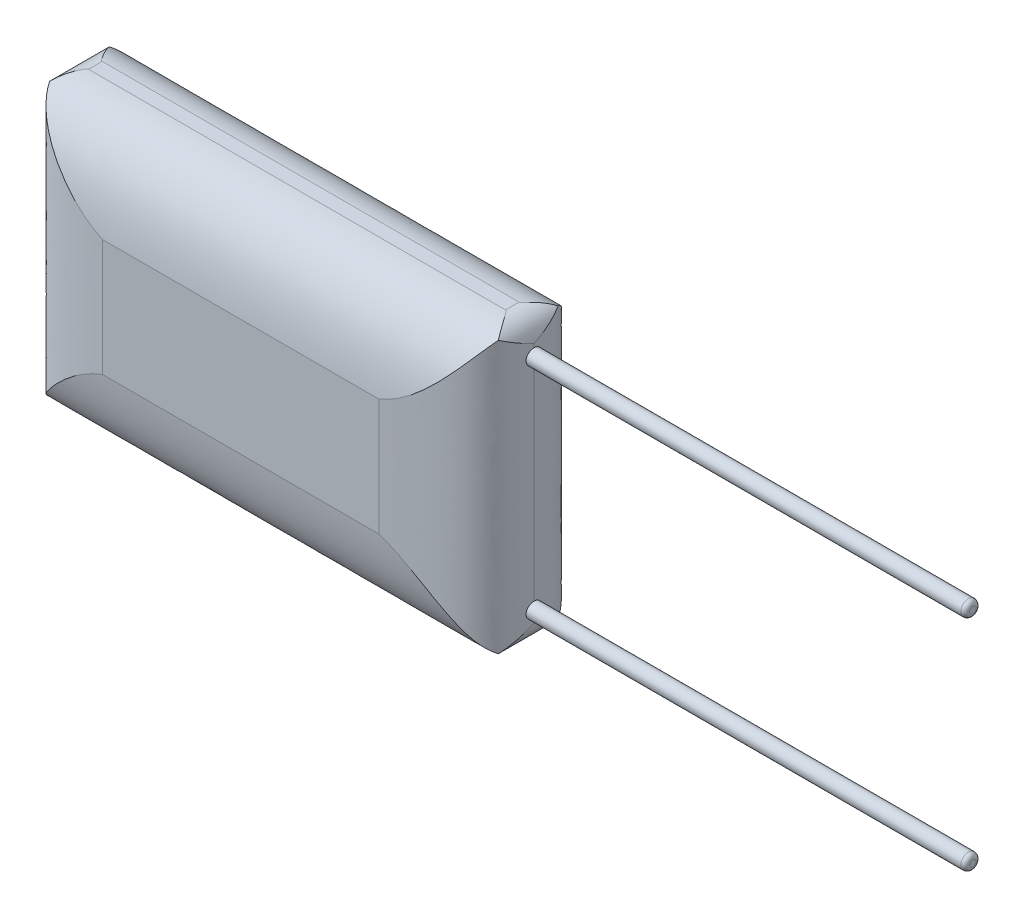
from build123d import *

# Parameters (mm, degrees)
BOSS_EXTRUDE1_DEPTH     = 3
CUT_EXTRUDE1_DEPTH      = 10.5
CUT_EXTRUDE3_DEPTH      = 6.5
CUT_EXTRUDE4_DEPTH      = 6.5
BOSS_EXTRUDE3_START     = 5.241286696
BOSS_EXTRUDE3_OUTLINE_R = 0.175
BOSS_EXTRUDE3_DEPTH     = 10.008713304
BOSS_EXTRUDE4_START     = 5.241286696
BOSS_EXTRUDE4_OUTLINE_R = 0.175
BOSS_EXTRUDE4_DEPTH     = 10.008713304
FILLET5_R               = 0.1


# Read off the part's stored shape, not the designer's step: Boss-Extrude3, Boss-Extrude4
with BuildPart() as part:
    # Sketch1 → Boss-Extrude1 (new body)
    with BuildSketch(Plane.XY):
        with BuildLine():
            Line((-4.75, 3.25), (4.75, 3.25))
            ThreePointArc((4.75, 3.25), (5.103553391, 3.103553391), (5.25, 2.75))
            Line((5.25, 2.75), (5.25, -2.75))
            ThreePointArc((5.25, -2.75), (5.103553391, -3.103553391), (4.75, -3.25))
            Line((4.75, -3.25), (-4.75, -3.25))
            ThreePointArc((-4.75, -3.25), (-5.103553391, -3.103553391), (-5.25, -2.75))
            Line((-5.25, -2.75), (-5.25, 2.75))
            ThreePointArc((-5.25, 2.75), (-5.103553391, 3.103553391), (-4.75, 3.25))
        make_face()
    extrude(amount=BOSS_EXTRUDE1_DEPTH)

    # Sketch2 → Cut-Extrude1 (cut)
    with BuildSketch(Plane.ZY.offset(5.25)):
        with BuildLine():
            Line((1.34430207, 3.25), (0, 3.25))
            Line((0, 3.25), (0, 2.75))
            Line((0, 2.75), (0.47517162, 2.75))
            add(Edge.make_bspline(
                [(1.34430207, 3.25), (0.960479897, 3.229816086), (0.678650256, 3.056054513), (0.47517162, 2.75)],
                knots=[0.045040828, 0.045040828, 0.045040828, 0.045040828, 0.389820888, 0.389820888, 0.389820888, 0.389820888], degree=3))
        make_face()
        with BuildLine():
            Line((0.47517162, 2.75), (0, 2.75))
            Line((0, 2.75), (0, 0))
            add(Edge.make_bspline(
                [(0.47517162, 2.75), (0.115062589, 2.20835594), (0.000353784, 1.252362148), (0, 0)],
                knots=[0.389820888, 0.389820888, 0.389820888, 0.389820888, 1, 1, 1, 1], degree=3))
        make_face()
        with BuildLine():
            Line((3, 3.25), (1.65569793, 3.25))
            add(Edge.make_bspline(
                [(1.65569793, 3.25), (2.039520103, 3.229816086), (2.321349744, 3.056054513), (2.52482838, 2.75)],
                knots=[0.045040828, 0.045040828, 0.045040828, 0.045040828, 0.389820888, 0.389820888, 0.389820888, 0.389820888], degree=3))
            Line((2.52482838, 2.75), (3, 2.75))
            Line((3, 2.75), (3, 3.25))
        make_face()
        with BuildLine():
            Line((3, 2.75), (2.52482838, 2.75))
            add(Edge.make_bspline(
                [(2.52482838, 2.75), (2.884937411, 2.20835594), (2.999646216, 1.252362148), (3, 0)],
                knots=[0.389820888, 0.389820888, 0.389820888, 0.389820888, 1, 1, 1, 1], degree=3))
            Line((3, 0), (3, 2.75))
        make_face()
        with BuildLine():
            Line((3, -2.75), (3, 0))
            add(Edge.make_bspline(
                [(2.52482838, -2.75), (2.884937411, -2.20835594), (2.999646216, -1.252362148), (3, 0)],
                knots=[0.389820888, 0.389820888, 0.389820888, 0.389820888, 1, 1, 1, 1], degree=3))
            Line((2.52482838, -2.75), (3, -2.75))
        make_face()
        with BuildLine():
            Line((3, -2.75), (2.52482838, -2.75))
            add(Edge.make_bspline(
                [(1.65569793, -3.25), (2.039520103, -3.229816086), (2.321349744, -3.056054513), (2.52482838, -2.75)],
                knots=[0.045040828, 0.045040828, 0.045040828, 0.045040828, 0.389820888, 0.389820888, 0.389820888, 0.389820888], degree=3))
            Line((1.65569793, -3.25), (3, -3.25))
            Line((3, -3.25), (3, -2.75))
        make_face()
        with BuildLine():
            Line((0.47517162, -2.75), (0, -2.75))
            Line((0, -2.75), (0, -3.25))
            Line((0, -3.25), (1.34430207, -3.25))
            add(Edge.make_bspline(
                [(1.34430207, -3.25), (0.960479897, -3.229816086), (0.678650256, -3.056054513), (0.47517162, -2.75)],
                knots=[0.045040828, 0.045040828, 0.045040828, 0.045040828, 0.389820888, 0.389820888, 0.389820888, 0.389820888], degree=3))
        make_face()
        with BuildLine():
            add(Edge.make_bspline(
                [(0.47517162, -2.75), (0.115062589, -2.20835594), (0.000353784, -1.252362148), (0, 0)],
                knots=[0.389820888, 0.389820888, 0.389820888, 0.389820888, 1, 1, 1, 1], degree=3))
            Line((0, 0), (0, -2.75))
            Line((0, -2.75), (0.47517162, -2.75))
        make_face()
    extrude(amount=-CUT_EXTRUDE1_DEPTH, mode=Mode.SUBTRACT)

    # Sketch4 → Cut-Extrude3 (cut)
    with BuildSketch(Plane.XZ.offset(3.25)):
        with BuildLine():
            Line((-5.25, 3), (-5.25, 1.5))
            add(Edge.make_bspline(
                [(-5.25, 1.5), (-5.223992888, 3.31984165), (-3.374680022, 2.849797455), (0, 3)],
                knots=[0, 0, 0, 0, 1, 1, 1, 1], degree=3))
            Line((0, 3), (-5.25, 3))
        make_face()
        with BuildLine():
            Line((-5.25, 1.5), (-5.25, 0))
            Line((-5.25, 0), (0, 0))
            add(Edge.make_bspline(
                [(-5.25, 1.5), (-5.223992888, -0.31984165), (-3.374680022, 0.150202545), (0, 0)],
                knots=[0, 0, 0, 0, 1, 1, 1, 1], degree=3))
        make_face()
        with BuildLine():
            add(Edge.make_bspline(
                [(5.25, 1.5), (5.223992888, -0.31984165), (3.374680022, 0.150202545), (0, 0)],
                knots=[0, 0, 0, 0, 1, 1, 1, 1], degree=3))
            Line((0, 0), (5.25, 0))
            Line((5.25, 0), (5.25, 1.5))
        make_face()
        with BuildLine():
            Line((5.25, 3), (0, 3))
            add(Edge.make_bspline(
                [(5.25, 1.5), (5.223992888, 3.31984165), (3.374680022, 2.849797455), (0, 3)],
                knots=[0, 0, 0, 0, 1, 1, 1, 1], degree=3))
            Line((5.25, 1.5), (5.25, 3))
        make_face()
    extrude(amount=-CUT_EXTRUDE3_DEPTH, mode=Mode.SUBTRACT)

    # Sketch5 → Cut-Extrude4 (cut)
    with BuildSketch(Plane.XZ.offset(3.25)):
        Polygon((0, 2.938709394), (4.861969398, 2.938709394), (4.861969398, 3.310845171), (-5.594143983, 3.310845171), (-5.594143983, 2.938709394), align=None)
        Polygon((-5.594143983, 0.061290606), (-5.594143983, -0.310845171), (4.861969398, -0.310845171), (4.861969398, 0.061290606), (0, 0.061290606), align=None)
    extrude(amount=-CUT_EXTRUDE4_DEPTH, mode=Mode.SUBTRACT)

    # Boss-Extrude3 outline → Boss-Extrude3 (add)
    with BuildSketch(Plane.YZ.offset(BOSS_EXTRUDE3_START)):
        with Locations((2.500000002, 1.5)):
            Circle(BOSS_EXTRUDE3_OUTLINE_R)
    extrude(amount=BOSS_EXTRUDE3_DEPTH)

    # Boss-Extrude4 outline → Boss-Extrude4 (add)
    with BuildSketch(Plane.YZ.offset(BOSS_EXTRUDE4_START)):
        with Locations((-2.499999998, 1.5)):
            Circle(BOSS_EXTRUDE4_OUTLINE_R)
    extrude(amount=BOSS_EXTRUDE4_DEPTH)

    # Fillet5
    fillet5_edges = [part.edges().sort_by_distance(p)[0] for p in [
        (15.25, 2.325000002, 1.5),
        (15.25, -2.674999998, 1.5),
    ]]
    fillet(fillet5_edges, radius=FILLET5_R)


solid = part.part
